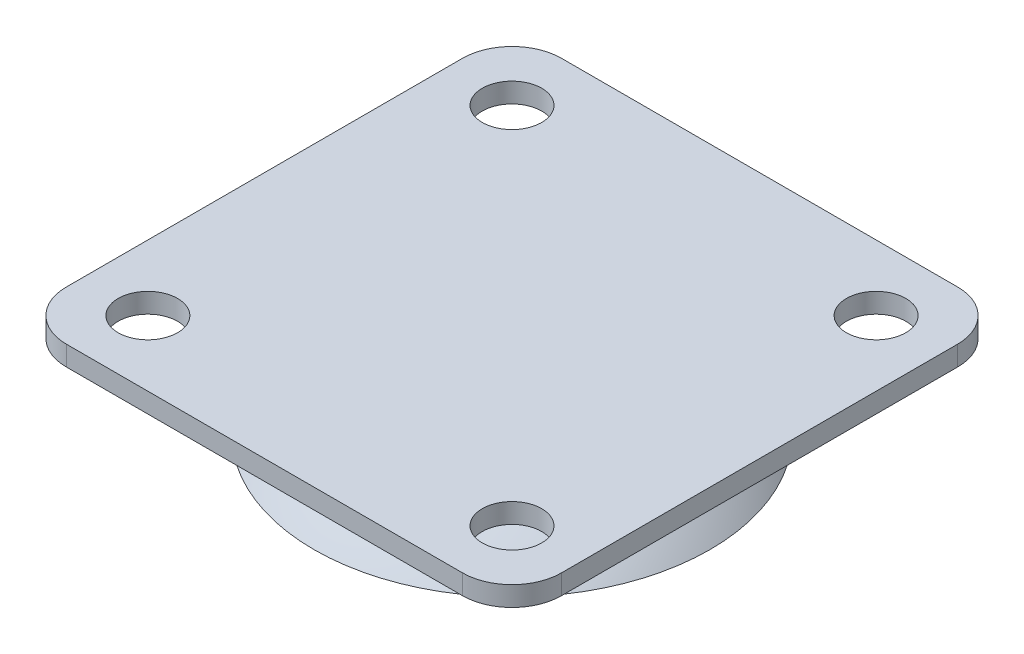
from build123d import *

# Parameters (mm, degrees)
SKETCH1_W           = 50
SKETCH1_H           = 50
SKETCH1_R           = 3
BOSS_EXTRUDE1_DEPTH = 2
FILLET1_R           = 5


with BuildPart() as part:
    # Sketch1 → Boss-Extrude1 (new body)
    with BuildSketch(Plane(origin=(0, 0, 0), x_dir=(1, 0, 0), z_dir=(0, 1, 0))):
        Rectangle(SKETCH1_W, SKETCH1_H)
        with Locations((18.384776311, 18.384776311)):
            Circle(SKETCH1_R, mode=Mode.SUBTRACT)
        with Locations((-18.384776311, 18.384776311)):
            Circle(SKETCH1_R, mode=Mode.SUBTRACT)
        with Locations((18.384776311, -18.384776311)):
            Circle(SKETCH1_R, mode=Mode.SUBTRACT)
        with Locations((-18.384776311, -18.384776311)):
            Circle(SKETCH1_R, mode=Mode.SUBTRACT)
    extrude(amount=BOSS_EXTRUDE1_DEPTH)

    # Fillet1
    fillet1_edges = [part.edges().sort_by_distance(p)[0] for p in [
        (25, 1, 25),
        (-25, 1, 25),
        (-25, 1, -25),
        (25, 1, -25),
    ]]
    fillet(fillet1_edges, radius=FILLET1_R)


with BuildPart() as body_2:
    # Sketch2 → Revolve1 (revolve)
    with BuildSketch(Plane.XY):
        with BuildLine():
            add(Edge.make_bspline(
                [(0, 0), (12.43840622, -0.079628335), (20, -8.468070288)],
                knots=[0, 0, 0, 1, 1, 1], degree=2))
            Line((0, 0), (0, -2.019980921))
            Line((0, -2.019980921), (1.99930643, -2.072647775))
            add(Edge.make_bspline(
                [(1.99930643, -2.072647775), (2.666007666, -2.117291662), (4.014019168, -2.251616435), (6.549499982, -2.683388344), (9.525407915, -3.533799384), (12.765394617, -5.035648817), (14.749449818, -6.380365871), (15.679001727, -7.124399167)],
                knots=[0.08723148, 0.08723148, 0.08723148, 0.08723148, 0.177417467, 0.267603454, 0.447975427, 0.628347401, 0.808719374, 0.808719374, 0.808719374, 0.808719374], degree=3))
            Line((15.679001727, -7.124399167), (17.160402388, -8.468070288))
            Line((17.160402388, -8.468070288), (20, -8.468070288))
        make_face()
    revolve(axis=Axis((0, 10.005953766, 0), (0, -1, 0)))


solid = Compound([part.part, body_2.part])
